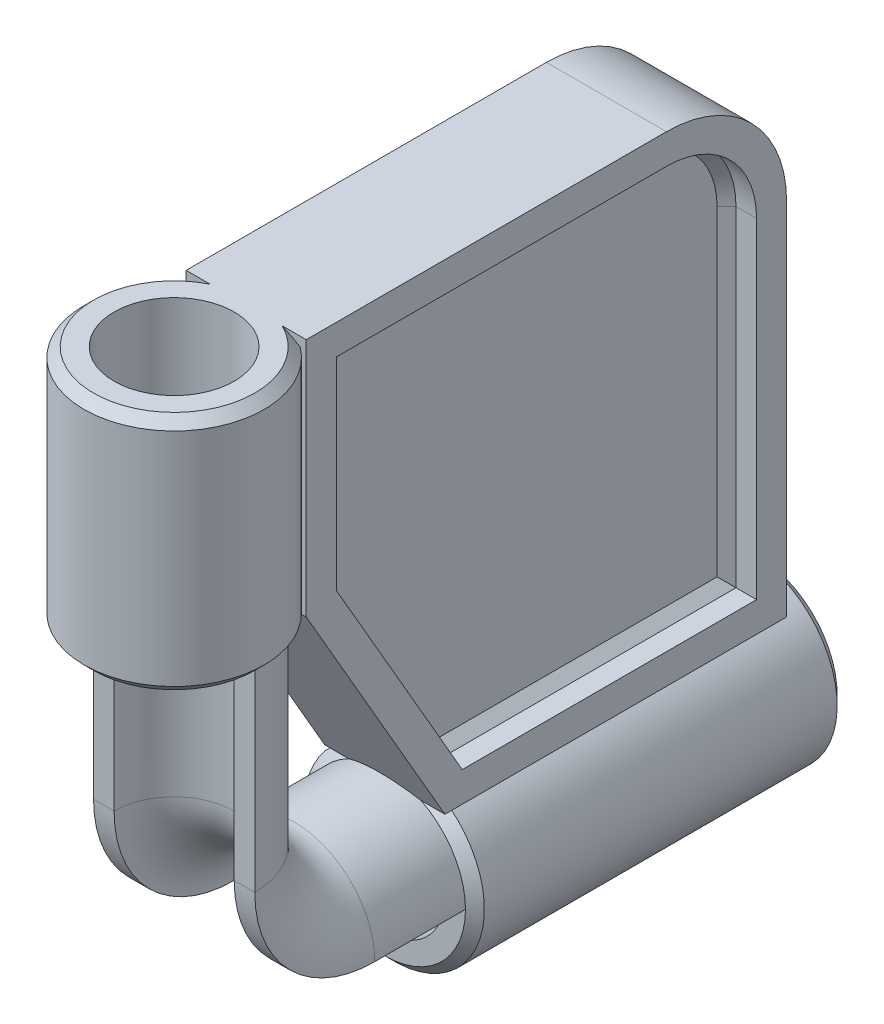
from build123d import *

# Parameters (mm, degrees)
BOSS_EXTRUDE1_DEPTH      = 6.35
FILLET1_R                = 12.7
CUT_EXTRUDE2_DEPTH       = 3.175
BOSS_EXTRUDE2_DEPTH      = 3.175
BOSS_EXTRUDE2_DEPTH_BACK = 36.135303
SKETCH4_R                = 9.525
SKETCH4_R_2              = 6.35
SKETCH5_R                = 9.525
SKETCH5_R_2              = 6.35
BOSS_EXTRUDE3_DEPTH      = 25.4
CHAMFER2_SIZE            = 1
CHAMFER4_SIZE            = 1


with BuildPart() as part:
    # Sketch1 → Boss-Extrude1 (new, symmetric)
    with BuildSketch(Plane.YZ):
        Polygon((-25.4, 10.735303163), (0, 25.4), (25.4, 25.4), (25.4, -25.4), (-25.4, -25.4), align=None)
    extrude(amount=BOSS_EXTRUDE1_DEPTH, both=True)

    # Fillet1
    fillet1_edges = [part.edges().sort_by_distance(p)[0] for p in [
        (0, 25.4, -25.4),
    ]]
    fillet(fillet1_edges, radius=FILLET1_R)

    # Sketch3 → Cut-Extrude2 (cut)
    with BuildSketch(Plane.YZ.offset(6.35)):
        with BuildLine():
            Line((-22.225, -22.225), (12.7, -22.225))
            ThreePointArc((12.7, -22.225), (19.435192091, -19.435192091), (22.225, -12.7))
            Line((22.225, -12.7), (22.225, 22.225))
            Line((22.225, 22.225), (0.850738686, 22.225))
            Line((0.850738686, 22.225), (-22.225, 8.902216058))
            Line((-22.225, 8.902216058), (-22.225, -22.225))
        make_face()
    cut_extrude2 = extrude(amount=-CUT_EXTRUDE2_DEPTH, mode=Mode.SUBTRACT)

    # Mirror1: Cut-Extrude2 across plane
    add(cut_extrude2.mirror(Plane(origin=(0, 0, 0), x_dir=(0, 0, 1), z_dir=(1, 0, 0))), mode=Mode.SUBTRACT)

    # Sketch4 → Boss-Extrude2 (add, two sides: drawn at the far end of the back side and taken through both)
    with BuildSketch(Plane(origin=(0, 0, -25.4), x_dir=(1, 0, 0), z_dir=(0, 0, -1)).offset(-BOSS_EXTRUDE2_DEPTH_BACK)):
        with Locations(Location((0, 33.02, 0), (0, 0, 233.130102354))):
            Circle(SKETCH4_R)
        with Locations(Location((0, 33.02, 0), (0, 0, 270))):
            Circle(SKETCH4_R_2, mode=Mode.SUBTRACT)
    extrude(amount=BOSS_EXTRUDE2_DEPTH + BOSS_EXTRUDE2_DEPTH_BACK)

    # Sketch5 → Boss-Extrude3 (add)
    with BuildSketch(Plane(origin=(0, 25.4, 0), x_dir=(-1, 0, 0), z_dir=(0, 1, 0))):
        with Locations((0, 33.02)):
            Circle(SKETCH5_R)
        with Locations(Location((0, 33.02, 0), (0, 0, 90))):
            Circle(SKETCH5_R_2, mode=Mode.SUBTRACT)
    extrude(amount=-BOSS_EXTRUDE3_DEPTH)

    # Chamfer2
    # the kernel refuses this chamfer: 1 mm, written as the material it takes off along each edge
    with BuildSketch(Plane(origin=(0, -33.02, 10.735303), x_dir=(0.3638595085405839, 0.931453841070294, 0), z_dir=(-0.931453841070294, 0.3638595085405839, 0))) as chamfer2_piece_1_section:
        Polygon((9.525, CHAMFER2_SIZE), (9.525 - CHAMFER2_SIZE, 0), (9.525, 0), align=None)
    chamfer2_piece_1 = revolve(axis=Axis((0, -33.02, 10.735303), (0, 0, -1)), revolution_arc=317.325176487, mode=Mode.PRIVATE)
    chamfer2_piece_1 = split(chamfer2_piece_1, bisect_by=Plane(origin=(5.777045626, -25.4, 10.24862198), z_dir=(0, -1, 0)), keep=Keep.TOP, mode=Mode.PRIVATE)
    add(chamfer2_piece_1, mode=Mode.SUBTRACT)
    with BuildSketch(Plane(origin=(0, -33.02, -28.575), x_dir=(-0.6000000000021781, 0.7999999999983665, 0), z_dir=(-0.7999999999983665, -0.6000000000021781, 0))) as chamfer2_piece_2:
        Polygon((9.525, -CHAMFER2_SIZE), (9.525 - CHAMFER2_SIZE, 0), (9.525, 0), align=None)
    revolve(axis=Axis((0, -33.02, -28.575), (0, 0, -1)), mode=Mode.SUBTRACT)
    with BuildSketch(Plane(origin=(0, 25.4, 33.02), x_dir=(-0.3638595085405501, 0, -0.9314538410703074), z_dir=(0.9314538410703074, 0, -0.3638595085405501))) as chamfer2_piece_3_section:
        Polygon((9.525, -CHAMFER2_SIZE), (9.525 - CHAMFER2_SIZE, 0), (9.525, 0), align=None)
    chamfer2_piece_3 = revolve(axis=Axis((0, 25.4, 33.02), (0, 1, 0)), revolution_arc=317.325176487, mode=Mode.PRIVATE)
    chamfer2_piece_3 = split(chamfer2_piece_3, bisect_by=Plane(origin=(0, 24.920234358, 25.4), z_dir=(0, 0, 1)), keep=Keep.TOP, mode=Mode.PRIVATE)
    add(chamfer2_piece_3, mode=Mode.SUBTRACT)
    with BuildSketch(Plane(origin=(0, 0, 33.02), x_dir=(-0.3638595085405531, 0, -0.9314538410703063), z_dir=(0.9314538410703063, 0, -0.3638595085405531))) as chamfer2_piece_4_section:
        Polygon((9.525, CHAMFER2_SIZE), (9.525 - CHAMFER2_SIZE, 0), (9.525, 0), align=None)
    chamfer2_piece_4 = revolve(axis=Axis((0, 0, 33.02), (0, 1, 0)), revolution_arc=317.325176487, mode=Mode.PRIVATE)
    chamfer2_piece_4 = split(chamfer2_piece_4, bisect_by=Plane(origin=(-5.452412952, 0.490850729, 25.4), z_dir=(0, 0, 1)), keep=Keep.TOP, mode=Mode.PRIVATE)
    add(chamfer2_piece_4, mode=Mode.SUBTRACT)

    # Sweep3: sweep along a path in Sketch6
    with BuildLine(Plane.YZ) as sweep3_path:
        Line((0, 33.02), (-20.32, 33.02))
        ThreePointArc((-20.32, 33.02), (-29.300256121, 29.300256121), (-33.02, 20.32))
        Line((-33.02, 20.32), (-33.02, 10.735303163))
    # Sketch7 → Sweep3 (sweep)
    with BuildSketch(Plane.XZ):
        with BuildLine():
            Line((-8.525, 33.02), (-6.35, 33.02))
            ThreePointArc((-6.35, 33.02), (0, 26.67), (6.35, 33.02))
            Line((6.35, 33.02), (8.525, 33.02))
            ThreePointArc((8.525, 33.02), (0, 24.495), (-8.525, 33.02))
        make_face()
    sweep(path=sweep3_path.line)

    # Chamfer4
    chamfer4_edges = [part.edges().sort_by_distance(p)[0] for p in [
        (3.175, -22.225, -6.661391971),
        (3.175, -10.687130657, 15.563608029),
        (3.175, 11.537869343, 22.225),
        (3.175, 22.225, 4.7625),
        (3.175, 19.435192091, -19.435192091),
        (3.175, -4.7625, -22.225),
        (-3.175, -22.225, -6.661391971),
        (-3.175, -4.7625, -22.225),
        (-3.175, 19.435192091, -19.435192091),
        (-3.175, 22.225, 4.7625),
        (-3.175, 11.537869343, 22.225),
        (-3.175, -10.687130657, 15.563608029),
    ]]
    chamfer(chamfer4_edges, length=CHAMFER4_SIZE)


solid = part.part
